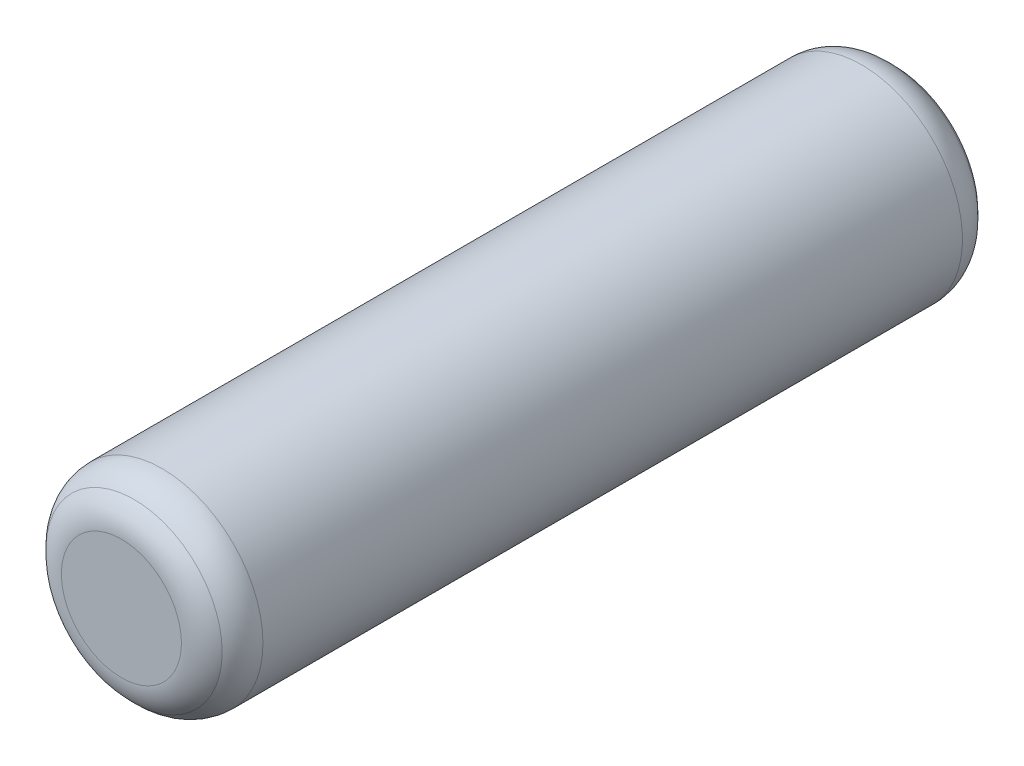
from build123d import *

# Parameters (mm, degrees)
SKETCH4_R           = 2
BOSS_EXTRUDE2_DEPTH = 15
SKETCH5_R           = 1.75
BOSS_EXTRUDE3_DEPTH = 0.25
FILLET3_R           = 0.75
SKETCH6_R           = 1.75
BOSS_EXTRUDE4_DEPTH = 0.25
FILLET4_R           = 0.75


with BuildPart() as part:
    # Sketch4 → Boss-Extrude2 (new body)
    with BuildSketch(Plane.XY):
        Circle(SKETCH4_R)
    extrude(amount=BOSS_EXTRUDE2_DEPTH)

    # Sketch5 → Boss-Extrude3 (add)
    with BuildSketch(Plane.XY.offset(15)):
        Circle(SKETCH5_R)
    extrude(amount=BOSS_EXTRUDE3_DEPTH)

    # Fillet3
    # the kernel refuses this fillet: 0.75 mm, written as the material it takes off along each edge
    with BuildSketch(Plane(origin=(0, 0, 15), x_dir=(1, 0, 0), z_dir=(0, -1, 0))) as fillet3_piece_1:
        with BuildLine():
            CenterArc((1.25, -0.559016994), FILLET3_R, 0, 48.189685104)
            Line((1.75, 0), (1.76, 0.01118034))
            ThreePointArc((1.76, 0.01118034), (1.875, 0.015), (2, 0.015))
            Line((2, 0.015), (2.015, 0))
            Line((2.015, 0), (2.015, -0.559016994))
            Line((2.015, -0.559016994), (2, -0.559016994))
        make_face()
    revolve(axis=Axis((0, 0, 15), (0, 0, 1)), mode=Mode.SUBTRACT)
    with BuildSketch(Plane(origin=(0, 0, 15.25), x_dir=(1, 0, 0), z_dir=(0, -1, 0))) as fillet3_piece_2:
        with BuildLine():
            CenterArc((1.190983006, -0.75), FILLET3_R, 41.810314896, 48.189685104)
            Line((1.190983006, 0), (1.190983006, 0.015))
            Line((1.190983006, 0.015), (1.75, 0.015))
            Line((1.75, 0.015), (1.765, 0))
            ThreePointArc((1.765, 0), (1.765, -0.125), (1.76118034, -0.24))
            Line((1.76118034, -0.24), (1.75, -0.25))
        make_face()
    revolve(axis=Axis((0, 0, 15.25), (0, 0, 1)), mode=Mode.SUBTRACT)

    # Sketch6 → Boss-Extrude4 (add)
    with BuildSketch(Plane(origin=(0, 0, 0), x_dir=(-1, 0, 0), z_dir=(0, 0, -1))):
        Circle(SKETCH6_R)
    extrude(amount=BOSS_EXTRUDE4_DEPTH)

    # Fillet4
    # the kernel refuses this fillet: 0.75 mm, written as the material it takes off along each edge
    with BuildSketch(Plane(origin=(0, 0, -0.25), x_dir=(-1, 0, 0), z_dir=(0, -1, 0))) as fillet4_piece_1:
        with BuildLine():
            CenterArc((1.190983006, -0.75), FILLET4_R, 41.810314896, 48.189685104)
            Line((1.190983006, 0), (1.190983006, 0.015))
            Line((1.190983006, 0.015), (1.75, 0.015))
            Line((1.75, 0.015), (1.765, 0))
            ThreePointArc((1.765, 0), (1.765, -0.125), (1.76118034, -0.24))
            Line((1.76118034, -0.24), (1.75, -0.25))
        make_face()
    revolve(axis=Axis((0, 0, -0.25), (0, 0, -1)), mode=Mode.SUBTRACT)
    with BuildSketch(Plane(origin=(0, 0, 0), x_dir=(1, 0, 0), z_dir=(0, -1, 0))) as fillet4_piece_2:
        with BuildLine():
            CenterArc((1.25, 0.559016994), FILLET4_R, 311.810314896, 48.189685104)
            Line((1.75, 0), (1.76, -0.01118034))
            ThreePointArc((1.76, -0.01118034), (1.875, -0.015), (2, -0.015))
            Line((2, -0.015), (2.015, 0))
            Line((2.015, 0), (2.015, 0.559016994))
            Line((2.015, 0.559016994), (2, 0.559016994))
        make_face()
    revolve(axis=Axis((0, 0, 0), (0, 0, 1)), mode=Mode.SUBTRACT)


solid = part.part
